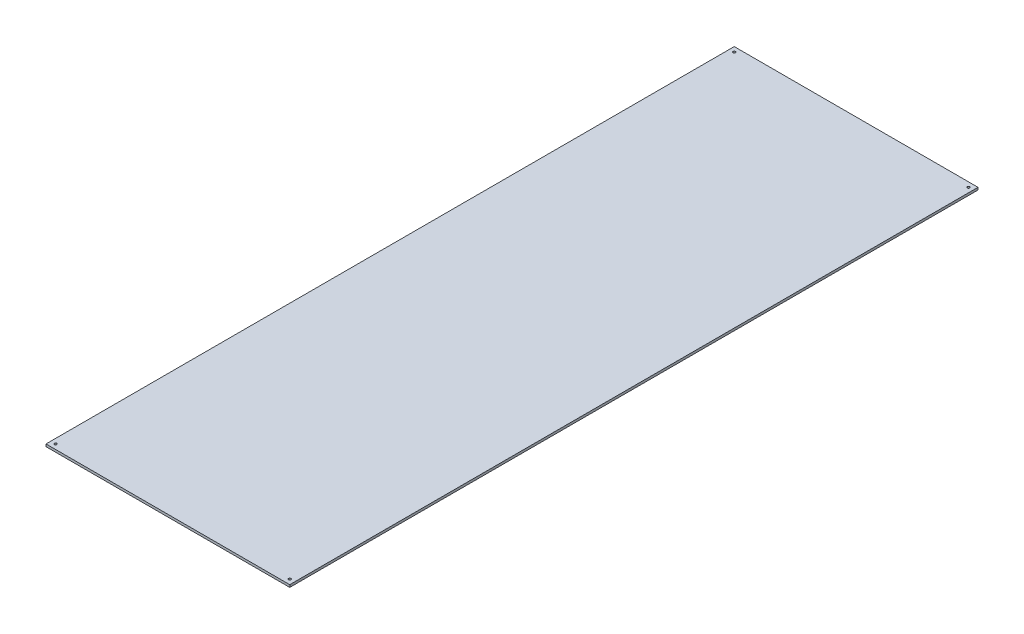
from build123d import *

# Parameters (mm, degrees)
SKETCH1_W           = 647.7
SKETCH1_H           = 1828.8
BOSS_EXTRUDE1_DEPTH = 6.35
SKETCH2_R           = 3.175
CUT_EXTRUDE1_DEPTH  = 971.075515102


with BuildPart() as part:
    # Sketch1 → Boss-Extrude1 (new body)
    with BuildSketch(Plane(origin=(0, 0, 0), x_dir=(1, 0, 0), z_dir=(0, 1, 0))):
        Rectangle(SKETCH1_W, SKETCH1_H)
    extrude(amount=BOSS_EXTRUDE1_DEPTH)

    # Sketch2 → Cut-Extrude1 (cut, through all)
    with BuildSketch(Plane(origin=(0, 6.35, 0), x_dir=(1, 0, 0), z_dir=(0, 1, 0))):
        with Locations((311.15, -901.7)):
            Circle(SKETCH2_R)
        with Locations((-311.15, -901.7)):
            Circle(SKETCH2_R)
        with Locations((311.15, 901.7)):
            Circle(SKETCH2_R)
        with Locations((-311.15, 901.7)):
            Circle(SKETCH2_R)
    extrude(amount=-CUT_EXTRUDE1_DEPTH, mode=Mode.SUBTRACT)


solid = part.part
